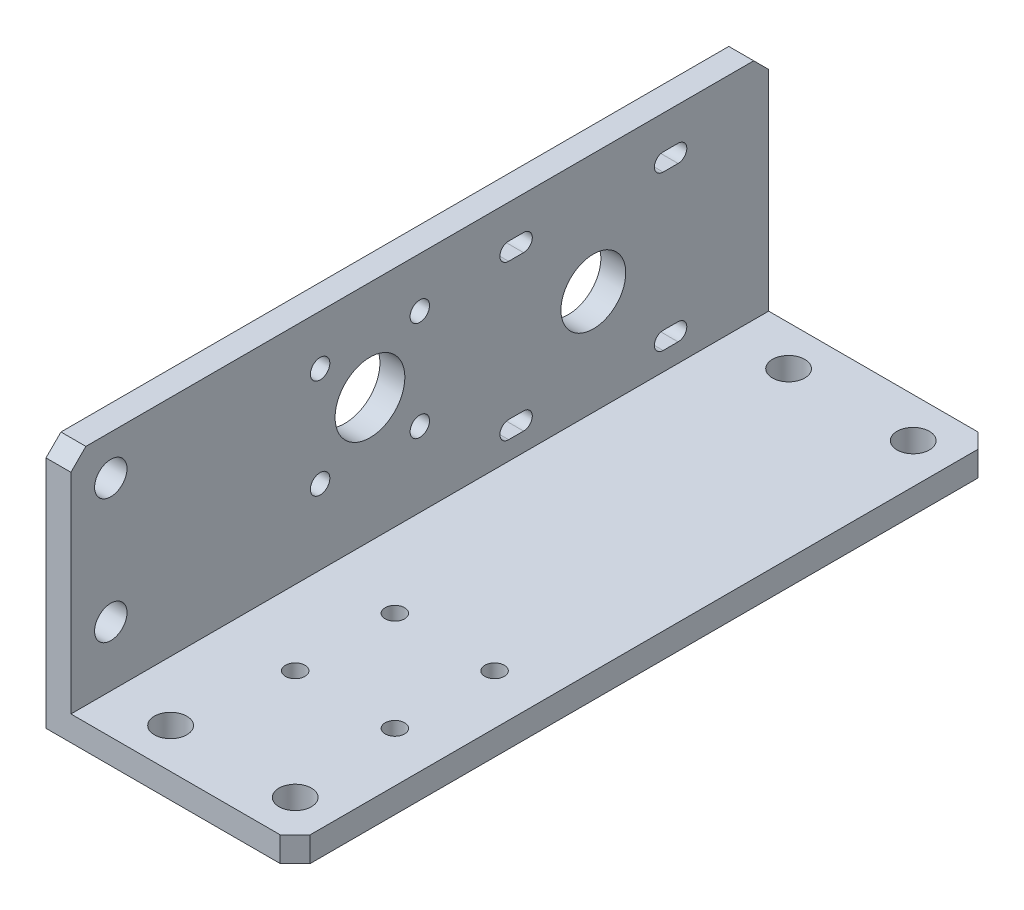
from build123d import *

# Parameters (mm, degrees)
ESTRUSIONE_ESTRUSIONE1_DEPTH = 140
FORO_6_5_6_5_1_D             = 6.5
FORO_6_5_6_5_2_D             = 6.5
FORO_6_5_6_5_2_DEPTH         = 5
FORO_6_5_6_5_2_TIP           = 1.952797012
TAGLIO_ESTRUSIONE3_REACH     = 158.844
SCHIZZO10_R                  = 7
TAGLIO_ESTRUSIONE6_REACH     = 158.844
SCHIZZO13_R                  = 6.5
SMUSSO1_SIZE                 = 3
M3_5_CLEARANCE_HOLE1_D       = 3.9
M3_5_CLEARANCE_HOLE2_D       = 3.9


with BuildPart() as part:
    # Schizzo1 → Estrusione-Estrusione1 (new body)
    with BuildSketch(Plane.XY):
        Polygon((0, 0), (0, 50), (5, 50), (5, 5), (50, 5), (50, 0), align=None)
    extrude(amount=ESTRUSIONE_ESTRUSIONE1_DEPTH)

    # Foro Ø6.5 (6.5)-1 (through all)
    with Locations(Plane(origin=(0, 0, 0), x_dir=(-1, 0, 0), z_dir=(0, -1, 0))):
        with Locations((-17, -132), (-42, -132)):
            foro_6_5_6_5_1 = Hole(FORO_6_5_6_5_1_D / 2)

    # Foro Ø6.5 (6.5)-2
    with Locations(Plane.ZY):
        with Locations((132, 42), (132, 17)):
            Hole(FORO_6_5_6_5_2_D / 2, depth=FORO_6_5_6_5_2_DEPTH)
            with Locations((0, 0, -(FORO_6_5_6_5_2_DEPTH + FORO_6_5_6_5_2_TIP / 2))):  # 118° drill point
                Cone(0, FORO_6_5_6_5_2_D / 2, FORO_6_5_6_5_2_TIP, mode=Mode.SUBTRACT)

    # Specchia1: Foro Ø6.5 (6.5)-1 across plane
    add(foro_6_5_6_5_1.mirror(Plane.XY.offset(70)), mode=Mode.SUBTRACT)

    # Schizzo10 → Taglio-Estrusione3 (cut, up to next)
    with BuildSketch(Plane.ZY, mode=Mode.PRIVATE) as taglio_estrusione3_sk1:
        with Locations((80, 30)):
            Circle(SCHIZZO10_R)
    taglio_estrusione3_tool1 = extrude(taglio_estrusione3_sk1.sketch, amount=-TAGLIO_ESTRUSIONE3_REACH, mode=Mode.PRIVATE) & part.part
    add(taglio_estrusione3_tool1.solids().sort_by_distance((0, 30, 80))[0], mode=Mode.SUBTRACT)

    # Schizzo13 → Taglio-Estrusione6 (cut, up to next)
    with BuildSketch(Plane.ZY, mode=Mode.PRIVATE) as taglio_estrusione6_sk1:
        with Locations((35.178130338, 26)):
            Circle(SCHIZZO13_R)
    taglio_estrusione6_tool1 = extrude(taglio_estrusione6_sk1.sketch, amount=-TAGLIO_ESTRUSIONE6_REACH, mode=Mode.PRIVATE) & part.part
    # Schizzo13 → Taglio-Estrusione6 (cut, up to next)
    with BuildSketch(Plane.ZY, mode=Mode.PRIVATE) as taglio_estrusione6_sk2:
        with BuildLine():
            Line((18.178130338, 43.25), (21.178130338, 43.25))
            ThreePointArc((21.178130338, 43.25), (22.928130338, 41.5), (21.178130338, 39.75))
            Line((21.178130338, 39.75), (18.178130338, 39.75))
            ThreePointArc((18.178130338, 39.75), (16.428130338, 41.5), (18.178130338, 43.25))
        make_face()
    taglio_estrusione6_tool2 = extrude(taglio_estrusione6_sk2.sketch, amount=-TAGLIO_ESTRUSIONE6_REACH, mode=Mode.PRIVATE) & part.part
    # Schizzo13 → Taglio-Estrusione6 (cut, up to next)
    with BuildSketch(Plane.ZY, mode=Mode.PRIVATE) as taglio_estrusione6_sk3:
        with BuildLine():
            Line((18.178130338, 8.75), (21.178130338, 8.75))
            ThreePointArc((21.178130338, 8.75), (22.928130338, 10.5), (21.178130338, 12.25))
            Line((21.178130338, 12.25), (18.178130338, 12.25))
            ThreePointArc((18.178130338, 12.25), (16.428130338, 10.5), (18.178130338, 8.75))
        make_face()
    taglio_estrusione6_tool3 = extrude(taglio_estrusione6_sk3.sketch, amount=-TAGLIO_ESTRUSIONE6_REACH, mode=Mode.PRIVATE) & part.part
    # Schizzo13 → Taglio-Estrusione6 (cut, up to next)
    with BuildSketch(Plane.ZY, mode=Mode.PRIVATE) as taglio_estrusione6_sk4:
        with BuildLine():
            Line((52.178130338, 43.25), (49.178130338, 43.25))
            ThreePointArc((49.178130338, 43.25), (47.428130338, 41.5), (49.178130338, 39.75))
            Line((49.178130338, 39.75), (52.178130338, 39.75))
            ThreePointArc((52.178130338, 39.75), (53.928130338, 41.5), (52.178130338, 43.25))
        make_face()
    taglio_estrusione6_tool4 = extrude(taglio_estrusione6_sk4.sketch, amount=-TAGLIO_ESTRUSIONE6_REACH, mode=Mode.PRIVATE) & part.part
    # Schizzo13 → Taglio-Estrusione6 (cut, up to next)
    with BuildSketch(Plane.ZY, mode=Mode.PRIVATE) as taglio_estrusione6_sk5:
        with BuildLine():
            Line((52.178130338, 8.75), (49.178130338, 8.75))
            ThreePointArc((49.178130338, 8.75), (47.428130338, 10.5), (49.178130338, 12.25))
            Line((49.178130338, 12.25), (52.178130338, 12.25))
            ThreePointArc((52.178130338, 12.25), (53.928130338, 10.5), (52.178130338, 8.75))
        make_face()
    taglio_estrusione6_tool5 = extrude(taglio_estrusione6_sk5.sketch, amount=-TAGLIO_ESTRUSIONE6_REACH, mode=Mode.PRIVATE) & part.part
    add(taglio_estrusione6_tool1.solids().sort_by_distance((0, 26, 35.17813))[0], mode=Mode.SUBTRACT)
    add(taglio_estrusione6_tool2.solids().sort_by_distance((0, 41.5, 19.67813))[0], mode=Mode.SUBTRACT)
    add(taglio_estrusione6_tool3.solids().sort_by_distance((0, 10.5, 19.67813))[0], mode=Mode.SUBTRACT)
    add(taglio_estrusione6_tool4.solids().sort_by_distance((0, 41.5, 50.67813))[0], mode=Mode.SUBTRACT)
    add(taglio_estrusione6_tool5.solids().sort_by_distance((0, 10.5, 50.67813))[0], mode=Mode.SUBTRACT)

    # Smusso1
    smusso1_edges = [part.edges().sort_by_distance(p)[0] for p in [
        (50, 2.5, 0),
        (2.5, 50, 0),
        (50, 2.5, 140),
        (2.5, 50, 140),
    ]]
    chamfer(smusso1_edges, length=SMUSSO1_SIZE)

    # M3.5 Clearance Hole1 (through all)
    with Locations(Plane(origin=(0, 40, 70), x_dir=(0, 0, -1), z_dir=(-1, 0, 0))):
        with Locations((0, 0), (-20, 0), (-20, 20), (0, 20)):
            Hole(M3_5_CLEARANCE_HOLE1_D / 2)

    # M3.5 Clearance Hole2 (through all)
    with Locations(Plane(origin=(20, 0, 110), x_dir=(-1, 0, 0), z_dir=(0, -1, 0))):
        with Locations((0, 0), (-20, 0), (-20, 20), (0, 20)):
            Hole(M3_5_CLEARANCE_HOLE2_D / 2)


solid = part.part
